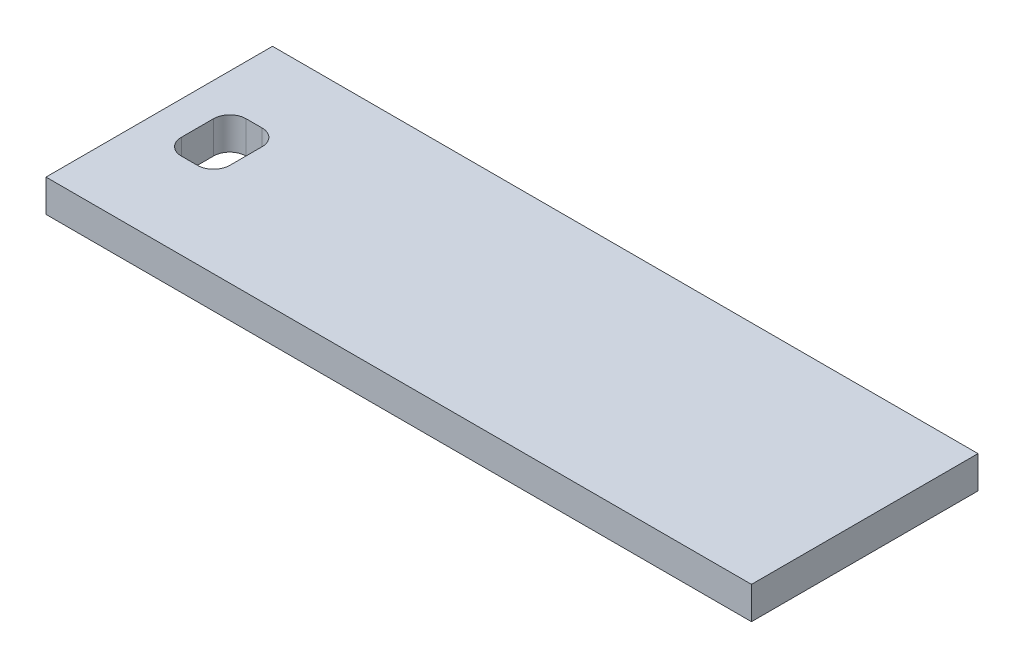
from build123d import *

# Parameters (mm, degrees)
SKETCH_1_W          = 218
SKETCH_1_H          = 70
EXTRUDE_1_DEPTH     = 10
SKETCH_2_W          = 15
SKETCH_2_H          = 20
CUT_EXTRUDE_1_DEPTH = 115.917361613
FILLET_1_R          = 5


with BuildPart() as part:
    # 草图1 → 凸台-拉伸1 (new body)
    with BuildSketch(Plane(origin=(0, 0, 0), x_dir=(1, 0, 0), z_dir=(0, 1, 0))):
        Rectangle(SKETCH_1_W, SKETCH_1_H)
    extrude(amount=EXTRUDE_1_DEPTH)

    # 草图2 → 切除-拉伸1 (cut, through all)
    with BuildSketch(Plane(origin=(0, 10, 0), x_dir=(1, 0, 0), z_dir=(0, 1, 0))):
        with Locations((-91.234833292, 1.528825843)):
            Rectangle(SKETCH_2_W, SKETCH_2_H)
    extrude(amount=-CUT_EXTRUDE_1_DEPTH, mode=Mode.SUBTRACT)

    # 圆角1
    fillet_1_edges = [part.edges().sort_by_distance(p)[0] for p in [
        (-98.734833292, 5, 8.471174157),
        (-83.734833292, 5, 8.471174157),
        (-83.734833292, 5, -11.528825843),
        (-98.734833292, 5, -11.528825843),
    ]]
    fillet(fillet_1_edges, radius=FILLET_1_R)


solid = part.part
